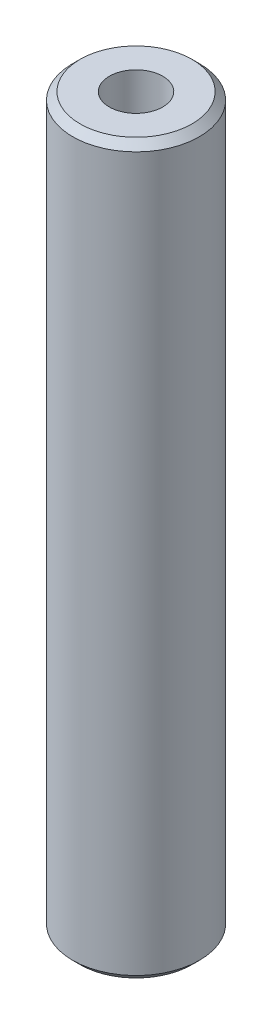
from build123d import *

# Parameters (mm, degrees)
SKETCH1_R           = 5
BOSS_EXTRUDE1_DEPTH = 57.452031266
SKETCH2_R           = 2.106898117
CUT_EXTRUDE1_DEPTH  = 58.885541343
CHAMFER1_SIZE       = 0.585060222


with BuildPart() as part:
    # Sketch1 → Boss-Extrude1 (new body)
    with BuildSketch(Plane(origin=(0, 0, 0), x_dir=(1, 0, 0), z_dir=(0, 1, 0))):
        Circle(SKETCH1_R)
    extrude(amount=BOSS_EXTRUDE1_DEPTH)

    # Sketch2 → Cut-Extrude1 (cut, through all)
    with BuildSketch(Plane(origin=(0, 0, 0), x_dir=(1, 0, 0), z_dir=(0, 1, 0))):
        Circle(SKETCH2_R)
    extrude(amount=CUT_EXTRUDE1_DEPTH, mode=Mode.SUBTRACT)

    # Chamfer1
    chamfer1_edges = [part.edges().sort_by_distance(p)[0] for p in [
        (-5, 57.452031266, 0),
        (-5, 0, 0),
    ]]
    chamfer(chamfer1_edges, length=CHAMFER1_SIZE)


solid = part.part
